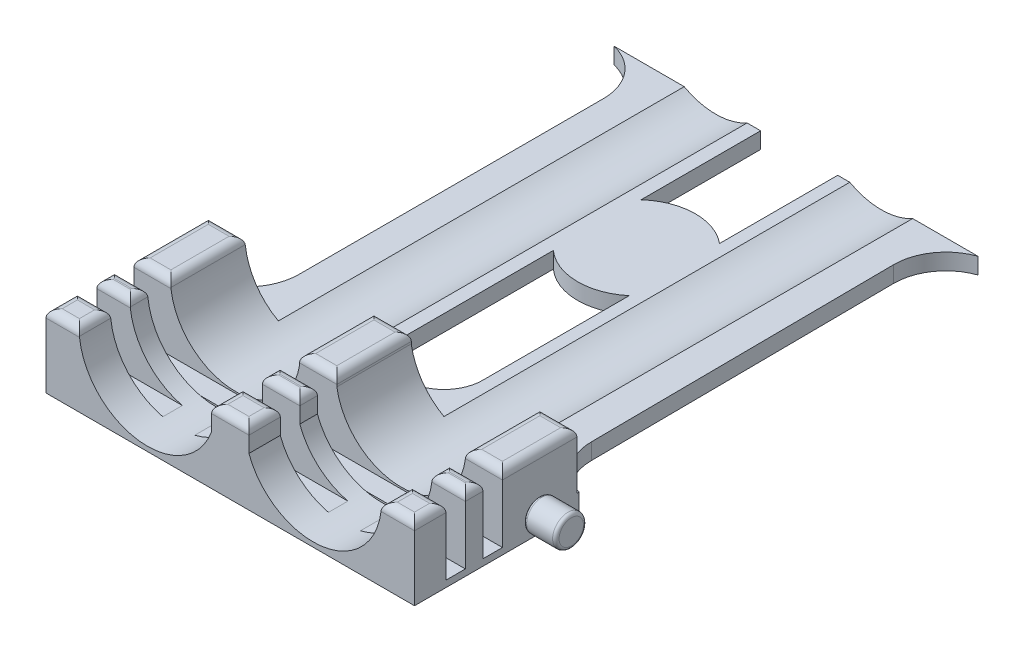
from build123d import *

# Parameters (mm, degrees)
SKETCH1_W           = 25
SKETCH1_H           = 90
BOSS_EXTRUDE1_DEPTH = 9
SKETCH4_W           = 8
SKETCH4_H           = 71
SKETCH5_W           = 25
SKETCH5_H           = 2.4
SKETCH5_W_2         = 28
FLANGE_SLOT_DEPTH   = 8.2
SKETCH6_W           = 8.432931683
SKETCH6_H           = 8.432931683
SKETCH18_W          = 25
SKETCH18_H          = 50
SYRINGE_BAY_DEPTH   = 7
SKETCH26_W          = 38.352553791
SKETCH26_H          = 20.215566654
CUT_EXTRUDE14_DEPTH = 10
LPATTERN3_COUNT     = 2
LPATTERN3_PITCH     = 20.4
SKETCH31_R          = 1.9
CUT_EXTRUDE16_DEPTH = 4
SKETCH33_R          = 1.9
BOSS_EXTRUDE2_DEPTH = 4
FILLET1_R           = 0.4
FILLET2_R           = 0.6
CUT_EXTRUDE17_DEPTH = 10
FILLET7_R           = 1


with BuildPart() as part:
    # Sketch1 → Boss-Extrude1 (new body)
    with BuildSketch(Plane(origin=(0, 0, 0), x_dir=(1, 0, 0), z_dir=(0, 1, 0))):
        Rectangle(SKETCH1_W, SKETCH1_H)
    extrude(amount=BOSS_EXTRUDE1_DEPTH)

    # Sketch4 → Syringe Body slot (revolve, cut)
    with BuildSketch(Plane(origin=(0, 9, 0), x_dir=(1, 0, 0), z_dir=(0, 1, 0))):
        with Locations((-4, 1.3)):
            Rectangle(SKETCH4_W, SKETCH4_H)
    revolve(axis=Axis((0, 9, -36.8), (0, 0, 1)), mode=Mode.SUBTRACT)

    # Sketch5 → Flange Slot (cut)
    with BuildSketch(Plane(origin=(0, 9, 0), x_dir=(1, 0, 0), z_dir=(0, 1, 0))):
        with Locations((0, -35.367068317)):
            Rectangle(SKETCH5_W, SKETCH5_H)
        with Locations((0, -39.936134865)):
            Rectangle(SKETCH5_W_2, SKETCH5_H)
    extrude(amount=-FLANGE_SLOT_DEPTH, mode=Mode.SUBTRACT)

    # Sketch6 → Plunger Slot (revolve, cut)
    with BuildSketch(Plane(origin=(0, 9, 0), x_dir=(1, 0, 0), z_dir=(0, 1, 0))):
        with Locations((-4.216465842, -40.783534159)):
            Rectangle(SKETCH6_W, SKETCH6_H)
    revolve(axis=Axis((0, 9, 45), (0, 0, -1)), mode=Mode.SUBTRACT)

    # Sketch18 → Syringe Bay (cut)
    with BuildSketch(Plane(origin=(0, 9, 0), x_dir=(1, 0, 0), z_dir=(0, 1, 0))):
        Rectangle(SKETCH18_W, SKETCH18_H)
    extrude(amount=-SYRINGE_BAY_DEPTH, mode=Mode.SUBTRACT)

    # Sketch26 → Cut-Extrude14 (cut)
    with BuildSketch(Plane(origin=(0, 9, 0), x_dir=(1, 0, 0), z_dir=(0, 1, 0))):
        with Locations((-0.72363309, 35.107783327)):
            Rectangle(SKETCH26_W, SKETCH26_H)
    extrude(amount=-CUT_EXTRUDE14_DEPTH, mode=Mode.SUBTRACT)


with BuildPart() as lpattern3_1:
    # LPattern3: pattern copy
    add(part.part.moved(Location(Vector(1, 0, 0) * (1 * LPATTERN3_PITCH))))


with BuildPart() as part_1:
    add(part.part)

    # Sketch31 → Cut-Extrude16 (cut)
    with BuildSketch(Plane.ZY.offset(12.5)):
        with Locations((29.687280392, 2.231257616)):
            Circle(SKETCH31_R)
    extrude(amount=-CUT_EXTRUDE16_DEPTH, mode=Mode.SUBTRACT)

    # Fillet2
    # the kernel refuses this fillet: 0.6 mm, written as the material it adds along each edge
    with BuildSketch(Plane(origin=(-8.5, 2.231257616, 29.687280392), x_dir=(0, 0, 1), z_dir=(0, -1, 0))) as fillet2_piece_1:
        with BuildLine():
            CenterArc((1.9 - FILLET2_R, FILLET2_R), FILLET2_R, 270, 90)
            Line((1.9 - FILLET2_R, 0), (1.9, 0))
            Line((1.9, 0), (1.9, FILLET2_R))
        make_face()
    revolve(axis=Axis((-8.5, 2.231257616, 29.687280392), (-1, 0, 0)))
    # the kernel refuses this fillet: 0.6 mm, written as the material it takes off along each edge
    with BuildSketch(Plane(origin=(-12.5, 2.231257616, 29.687280392), x_dir=(0, 0, 1), z_dir=(0, -1, 0))) as fillet2_2_piece_1:
        with BuildLine():
            CenterArc((1.9 + FILLET2_R, -FILLET2_R), FILLET2_R, 90, 90)
            Line((1.9, -FILLET2_R), (1.9, 0))
            Line((1.9, 0), (1.9 + FILLET2_R, 0))
        make_face()
    revolve(axis=Axis((-12.5, 2.231257616, 29.687280392), (-1, 0, 0)), mode=Mode.SUBTRACT)


with BuildPart() as body_3:
    # Sketch33 → Boss-Extrude2 (new body)
    with BuildSketch(Plane(origin=(32.9, 0, 0), x_dir=(0, 0, -1), z_dir=(1, 0, 0))):
        with Locations((-29.687280392, 2.231257616)):
            Circle(SKETCH33_R)
    extrude(amount=BOSS_EXTRUDE2_DEPTH)

    # Fillet1
    fillet1_edges = [body_3.edges().sort_by_distance(p)[0] for p in [
        (32.9, 2.231257616, 31.587280392),
        (36.9, 2.231257616, 31.587280392),
    ]]
    fillet(fillet1_edges, radius=FILLET1_R)


with BuildPart() as cut_extrude17_tool:
    # Sketch35 → Cut-Extrude17 (new body)
    with BuildSketch(Plane(origin=(0, 2, 0), x_dir=(1, 0, 0), z_dir=(0, 1, 0))):
        with BuildLine():
            Line((-7.572519934, 18.75), (-7.572519934, -18.75))
            ThreePointArc((-7.572519934, -18.75), (-14, -25.177480066), (-20.427480066, -18.75))
            Line((-20.427480066, -18.75), (-20.427480066, 18.75))
            ThreePointArc((-20.427480066, 18.75), (-14, 25.177480066), (-7.572519934, 18.75))
        make_face()
        with BuildLine():
            Line((15.038012539, 25.284497927), (15.038012539, 10.435091669))
            ThreePointArc((15.038012539, 10.435091669), (10.258664257, 12.127791533), (5.538012539, 10.277696889))
            Line((5.538012539, 10.277696889), (5.538012539, 25.284497927))
            ThreePointArc((5.538012539, 25.284497927), (10.288012539, 30.034497927), (15.038012539, 25.284497927))
        make_face()
        with BuildLine():
            Line((28.019587368, 18.885486869), (28.305082347, -18.61342635))
            ThreePointArc((28.305082347, -18.61342635), (34.781309827, -24.991786455), (41.159669932, -18.515558975))
            Line((41.159669932, -18.515558975), (40.874174953, 18.983354244))
            ThreePointArc((40.874174953, 18.983354244), (34.397947473, 25.361714349), (28.019587368, 18.885486869))
        make_face()
        with BuildLine():
            Line((15.038012539, -0.688026199), (15.038012539, -18.75))
            ThreePointArc((15.038012539, -18.75), (10.288012539, -23.5), (5.538012539, -18.75))
            Line((5.538012539, -18.75), (5.538012539, -0.530631419))
            ThreePointArc((5.538012539, -0.530631419), (10.258664257, -2.380726063), (15.038012539, -0.688026199))
        make_face()
    extrude(amount=-CUT_EXTRUDE17_DEPTH)


with BuildPart() as part_2:
    add(part_1.part)

    # Cut-Extrude17: cut by cut_extrude17_tool
    add(cut_extrude17_tool.part, mode=Mode.SUBTRACT)


with BuildPart() as lpattern3_1_1:
    add(lpattern3_1.part)

    # Cut-Extrude17: cut by cut_extrude17_tool
    add(cut_extrude17_tool.part, mode=Mode.SUBTRACT)

    # Combine2: union part, body 3
    add(part_2.part)
    add(body_3.part)

    # Fillet7
    fillet7_edges = [lpattern3_1_1.edges().sort_by_distance(p)[0] for p in [
        (7.9, 9, 29.583534158),
        (10.2, 9, 25),
        (30.65, 9, 25),
        (10.2, 9, 45),
        (32.9, 9, 37.651601591),
        (32.9, 9, 29.583534158),
        (7.9, 9, 37.651601591),
        (7.9, 9, 43.068067433),
        (10.2, 9, 41.136134865),
        (30.866465842, 9, 38.736134865),
        (-10.25, 9, 34.167068317),
        (12.5, 9, 37.651601591),
        (12.5, 9, 43.068067433),
        (-8.432931683, 9, 37.651601591),
        (-8.432931683, 9, 43.068067433),
        (-12.5, 9, 29.583534158),
        (-8, 9, 29.583534158),
        (12.5, 9, 29.583534158),
        (-12.5, 9, 37.651601591),
        (-12.5, 9, 43.068067433),
        (-10.466465842, 9, 45),
        (-10.466465842, 9, 38.736134865),
        (-10.466465842, 9, 36.567068317),
        (-10.466465842, 9, 41.136134865),
        (-10.25, 9, 25),
        (10.2, 9, 34.167068317),
        (10.2, 9, 36.567068317),
        (30.65, 9, 34.167068317),
        (32.9, 9, 43.068067433),
        (10.2, 9, 38.736134865),
        (30.866465842, 9, 41.136134865),
        (30.866465842, 9, 36.567068317),
        (30.866465842, 9, 45),
        (28.832931683, 9, 37.651601591),
        (28.832931683, 9, 43.068067433),
        (28.4, 9, 29.583534158),
    ]]
    fillet(fillet7_edges, radius=FILLET7_R)


solid = lpattern3_1_1.part
